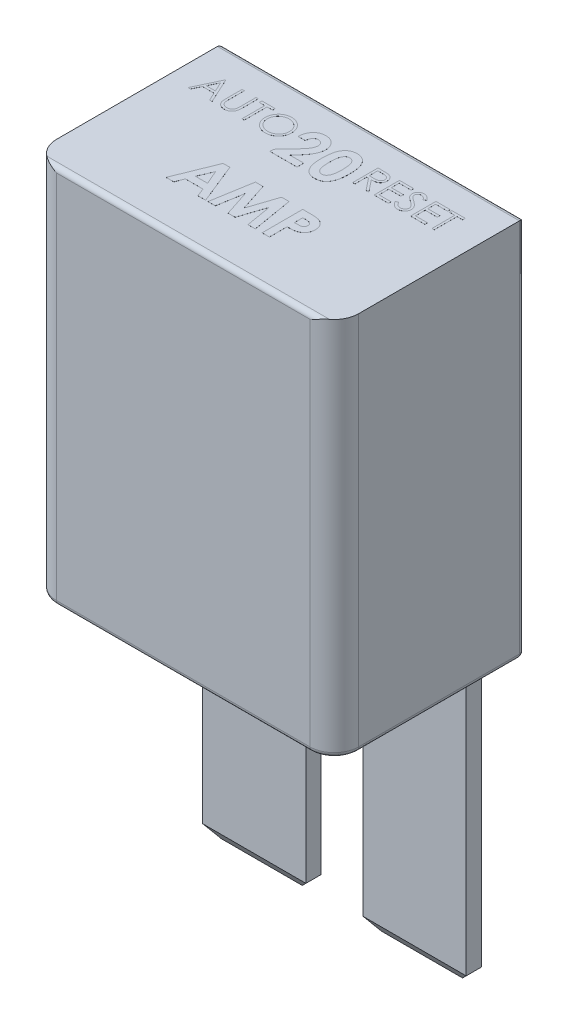
from build123d import *

# Parameters (mm, degrees)
SKETCH1_W                  = 15.748
SKETCH1_H                  = 9.906
EXTRUDE1_DEPTH             = 19.812
FILLET1_R                  = 1.27
FILLET2_R                  = 0.254
SKETCH2_W                  = 5.3848
SKETCH2_H                  = 0.7874
EXTRUDE2_DEPTH             = 14.478
CHAMFER1_SIZE              = 0.5842
CHAMFER2_SIZE              = 0.5842
CHAMFER2_SIZE_2            = 0.394047876
CHAMFER1_OF_MIRROR1_SIZE   = 0.5842
CHAMFER2_OF_MIRROR1_SIZE   = 0.394047876
CHAMFER2_OF_MIRROR1_SIZE_2 = 0.5842
EXTRUDE3_DEPTH             = 0.00254


with BuildPart() as part:
    # Sketch1 → Extrude1 (new body)
    with BuildSketch(Plane(origin=(0, 0, 0), x_dir=(1, 0, 0), z_dir=(0, 1, 0))):
        Rectangle(SKETCH1_W, SKETCH1_H)
    extrude(amount=EXTRUDE1_DEPTH)

    # Fillet1
    fillet1_edges = [part.edges().sort_by_distance(p)[0] for p in [
        (7.874, 9.906, 4.953),
        (-7.874, 9.906, 4.953),
    ]]
    fillet(fillet1_edges, radius=FILLET1_R)

    # Fillet2
    # the kernel refuses this fillet: 0.254 mm, written as the material it takes off along each edge
    with BuildSketch(Plane(origin=(7.62, 0.254, -4.699), x_dir=(1, 0, 0), z_dir=(0, -1, 0))) as fillet2_piece_1_section:
        Polygon((0, 0), (FILLET2_R * 1.02, 0), (FILLET2_R * 1.02, -FILLET2_R * 1.02), (0, -FILLET2_R * 1.02), align=None)
    fillet2_piece_1 = extrude(amount=FILLET2_R * 1.02, mode=Mode.PRIVATE)
    fillet2_piece_1 = fillet2_piece_1 - Plane(origin=(7.62, 0.254, -4.699), x_dir=(-0.7071067811865475, 0, 0.7071067811865475), z_dir=(0, -1, 0)) * Sphere(FILLET2_R, mode=Mode.PRIVATE)
    add(fillet2_piece_1, mode=Mode.SUBTRACT)
    with BuildSketch(Plane(origin=(-7.62, 0.254, -4.699), x_dir=(-1, 0, 0), z_dir=(0, -1, 0))) as fillet2_piece_2_section:
        Polygon((0, 0), (FILLET2_R * 1.02, 0), (FILLET2_R * 1.02, FILLET2_R * 1.02), (0, FILLET2_R * 1.02), align=None)
    fillet2_piece_2 = extrude(amount=FILLET2_R * 1.02, mode=Mode.PRIVATE)
    fillet2_piece_2 = fillet2_piece_2 - Plane(origin=(-7.62, 0.254, -4.699), x_dir=(0.7071067811865475, 0, 0.7071067811865475), z_dir=(0, -1, 0)) * Sphere(FILLET2_R, mode=Mode.PRIVATE)
    add(fillet2_piece_2, mode=Mode.SUBTRACT)
    with BuildSketch(Plane(origin=(7.874, 0, 3.683), x_dir=(-1, 0, 0), z_dir=(0, 0, -1)), Plane(origin=(-7.874, 0, -4.699), x_dir=(1, 0, 0), z_dir=(0, 0, 1))) as fillet2_piece_3:
        with BuildLine():
            CenterArc((FILLET2_R, FILLET2_R), FILLET2_R, 180, 90)
            Line((0, FILLET2_R), (-FILLET2_R * 0.02, FILLET2_R))
            Line((-FILLET2_R * 0.02, FILLET2_R), (-FILLET2_R * 0.02, -FILLET2_R * 0.02))
            Line((-FILLET2_R * 0.02, -FILLET2_R * 0.02), (FILLET2_R, -FILLET2_R * 0.02))
            Line((FILLET2_R, -FILLET2_R * 0.02), (FILLET2_R, 0))
        make_face()
    extrude(amount=8.382, mode=Mode.SUBTRACT)
    with BuildSketch(Plane(origin=(-6.604, 0, 4.953), x_dir=(0, 1, 0), z_dir=(1, 0, 0))) as fillet2_piece_4:
        with BuildLine():
            CenterArc((FILLET2_R, -FILLET2_R), FILLET2_R, 90, 90)
            Line((0, -FILLET2_R), (-FILLET2_R * 0.02, -FILLET2_R))
            Line((-FILLET2_R * 0.02, -FILLET2_R), (-FILLET2_R * 0.02, FILLET2_R * 0.02))
            Line((-FILLET2_R * 0.02, FILLET2_R * 0.02), (FILLET2_R, FILLET2_R * 0.02))
            Line((FILLET2_R, FILLET2_R * 0.02), (FILLET2_R, 0))
        make_face()
    extrude(amount=13.208, mode=Mode.SUBTRACT)
    with BuildSketch(Plane(origin=(-6.604, 0, 3.683), x_dir=(0, 0, 1), z_dir=(1, 0, 0))) as fillet2_piece_5:
        with BuildLine():
            CenterArc((1.27 - FILLET2_R, -FILLET2_R), FILLET2_R, 0, 90)
            Line((1.27, -FILLET2_R), (1.27 + FILLET2_R * 0.02, -FILLET2_R))
            Line((1.27 + FILLET2_R * 0.02, -FILLET2_R), (1.27 + FILLET2_R * 0.02, FILLET2_R * 0.02))
            Line((1.27 + FILLET2_R * 0.02, FILLET2_R * 0.02), (1.27 - FILLET2_R, FILLET2_R * 0.02))
            Line((1.27 - FILLET2_R, FILLET2_R * 0.02), (1.27 - FILLET2_R, 0))
        make_face()
    revolve(axis=Axis((-6.604, 0, 3.683), (0, -1, 0)), revolution_arc=90, mode=Mode.SUBTRACT)
    with BuildSketch(Plane(origin=(6.604, 0, 3.683), x_dir=(0, 0, 1), z_dir=(-1, 0, 0))) as fillet2_piece_6:
        with BuildLine():
            CenterArc((1.27 - FILLET2_R, FILLET2_R), FILLET2_R, 270, 90)
            Line((1.27, FILLET2_R), (1.27 + FILLET2_R * 0.02, FILLET2_R))
            Line((1.27 + FILLET2_R * 0.02, FILLET2_R), (1.27 + FILLET2_R * 0.02, -FILLET2_R * 0.02))
            Line((1.27 + FILLET2_R * 0.02, -FILLET2_R * 0.02), (1.27 - FILLET2_R, -FILLET2_R * 0.02))
            Line((1.27 - FILLET2_R, -FILLET2_R * 0.02), (1.27 - FILLET2_R, 0))
        make_face()
    revolve(axis=Axis((6.604, 0, 3.683), (0, 1, 0)), revolution_arc=90, mode=Mode.SUBTRACT)
    with BuildSketch(Plane(origin=(-8.128, 19.812, 4.953), x_dir=(0, -1, 0), z_dir=(1, 0, 0))) as fillet2_piece_7:
        with BuildLine():
            CenterArc((FILLET2_R, FILLET2_R), FILLET2_R, 180, 90)
            Line((0, FILLET2_R), (-FILLET2_R * 0.02, FILLET2_R))
            Line((-FILLET2_R * 0.02, FILLET2_R), (-FILLET2_R * 0.02, -FILLET2_R * 0.02))
            Line((-FILLET2_R * 0.02, -FILLET2_R * 0.02), (FILLET2_R, -FILLET2_R * 0.02))
            Line((FILLET2_R, -FILLET2_R * 0.02), (FILLET2_R, 0))
        make_face()
    extrude(amount=16.256, mode=Mode.SUBTRACT)
    with BuildSketch(Plane(origin=(7.62, 0, -4.953), x_dir=(0, 0, 1), z_dir=(-1, 0, 0))) as fillet2_piece_8:
        with BuildLine():
            CenterArc((FILLET2_R, FILLET2_R), FILLET2_R, 180, 90)
            Line((0, FILLET2_R), (-FILLET2_R * 0.02, FILLET2_R))
            Line((-FILLET2_R * 0.02, FILLET2_R), (-FILLET2_R * 0.02, -FILLET2_R * 0.02))
            Line((-FILLET2_R * 0.02, -FILLET2_R * 0.02), (FILLET2_R, -FILLET2_R * 0.02))
            Line((FILLET2_R, -FILLET2_R * 0.02), (FILLET2_R, 0))
        make_face()
    extrude(amount=15.24, mode=Mode.SUBTRACT)
    with BuildSketch(Plane(origin=(9.398, 19.812, -4.953), x_dir=(0, 0, 1), z_dir=(-1, 0, 0))) as fillet2_piece_9:
        with BuildLine():
            CenterArc((FILLET2_R, -FILLET2_R), FILLET2_R, 90, 90)
            Line((0, -FILLET2_R), (-FILLET2_R * 0.02, -FILLET2_R))
            Line((-FILLET2_R * 0.02, -FILLET2_R), (-FILLET2_R * 0.02, FILLET2_R * 0.02))
            Line((-FILLET2_R * 0.02, FILLET2_R * 0.02), (FILLET2_R, FILLET2_R * 0.02))
            Line((FILLET2_R, FILLET2_R * 0.02), (FILLET2_R, 0))
        make_face()
    extrude(amount=18.796, mode=Mode.SUBTRACT)
    with BuildSketch(Plane(origin=(-7.874, 0.254, -4.953), x_dir=(0, 0, 1), z_dir=(0, 1, 0))) as fillet2_piece_10:
        with BuildLine():
            CenterArc((FILLET2_R, FILLET2_R), FILLET2_R, 180, 90)
            Line((0, FILLET2_R), (-FILLET2_R * 0.02, FILLET2_R))
            Line((-FILLET2_R * 0.02, FILLET2_R), (-FILLET2_R * 0.02, -FILLET2_R * 0.02))
            Line((-FILLET2_R * 0.02, -FILLET2_R * 0.02), (FILLET2_R, -FILLET2_R * 0.02))
            Line((FILLET2_R, -FILLET2_R * 0.02), (FILLET2_R, 0))
        make_face()
    extrude(amount=21.082, mode=Mode.SUBTRACT)
    with BuildSketch(Plane(origin=(7.874, 0.254, -4.953), x_dir=(0, 0, 1), z_dir=(0, 1, 0))) as fillet2_piece_11:
        with BuildLine():
            CenterArc((FILLET2_R, -FILLET2_R), FILLET2_R, 90, 90)
            Line((0, -FILLET2_R), (-FILLET2_R * 0.02, -FILLET2_R))
            Line((-FILLET2_R * 0.02, -FILLET2_R), (-FILLET2_R * 0.02, FILLET2_R * 0.02))
            Line((-FILLET2_R * 0.02, FILLET2_R * 0.02), (FILLET2_R, FILLET2_R * 0.02))
            Line((FILLET2_R, FILLET2_R * 0.02), (FILLET2_R, 0))
        make_face()
    extrude(amount=21.082, mode=Mode.SUBTRACT)

    # Sketch2 → Extrude2 (add)
    with BuildSketch(Plane.XZ):
        with Locations((-4.1783, -3.31978)):
            Rectangle(SKETCH2_W, SKETCH2_H)
    extrude2 = extrude(amount=EXTRUDE2_DEPTH)

    # Chamfer1
    chamfer1_edges = [part.edges().sort_by_distance(p)[0] for p in [
        (-1.4859, -14.478, -3.31978),
        (-6.8707, -14.478, -3.31978),
    ]]
    chamfer(chamfer1_edges, length=CHAMFER1_SIZE)

    # Chamfer2
    # the kernel refuses this chamfer: 0.5842, 0.394047876 mm, written as the material it takes off along each edge
    with BuildSketch(Plane(origin=(-7.795785962, -14.478, -3.71348), x_dir=(0, 0.9997657259302418, -0.021644705014774092), z_dir=(1, 0, 0)), Plane(origin=(-0.560814038, -14.478, -2.92608), x_dir=(0, 0.9997657259302418, 0.021644705014774092), z_dir=(-1, 0, 0))) as chamfer2_piece_1:
        Polygon((CHAMFER2_SIZE * 0.99976572593, CHAMFER2_SIZE * 0.0216447050148), (-CHAMFER2_SIZE_2 * 0.0216447049895, CHAMFER2_SIZE_2 * 0.999765724761), (0, 0), align=None)
    extrude(amount=7.234971923, mode=Mode.SUBTRACT)

    # Mirror1: Extrude2 across plane
    add(extrude2.mirror(Plane(origin=(0, 0, 0), x_dir=(0, 0, 1), z_dir=(1, 0, 0))))

    # Chamfer1 of Mirror1
    chamfer1_of_mirror1_edges = [part.edges().sort_by_distance(p)[0] for p in [
        (1.4859, -14.478, -3.31978),
        (6.8707, -14.478, -3.31978),
    ]]
    chamfer(chamfer1_of_mirror1_edges, length=CHAMFER1_OF_MIRROR1_SIZE)

    # Chamfer2 of Mirror1
    # the kernel refuses this chamfer: 0.5842, 0.394047876 mm, written as the material it takes off along each edge
    with BuildSketch(Plane(origin=(7.795785962, -14.478, -3.71348), x_dir=(0, -0.04753214298802765, 0.9988697089125117), z_dir=(-1, 0, 0))) as chamfer2_of_mirror1_piece_1:
        Polygon((CHAMFER2_OF_MIRROR1_SIZE * 0.998869707745, CHAMFER2_OF_MIRROR1_SIZE * 0.0475321429325), (-CHAMFER2_OF_MIRROR1_SIZE_2 * 0.047532142988, CHAMFER2_OF_MIRROR1_SIZE_2 * 0.998869708913), (0, 0), align=None)
    extrude(amount=7.234971923, mode=Mode.SUBTRACT)
    with BuildSketch(Plane(origin=(0.560814038, -14.478, -2.92608), x_dir=(0, 0.9997657259302418, 0.021644705014774092), z_dir=(1, 0, 0))) as chamfer2_of_mirror1_piece_2:
        Polygon((CHAMFER2_OF_MIRROR1_SIZE_2 * 0.99976572593, -CHAMFER2_OF_MIRROR1_SIZE_2 * 0.0216447050148), (-CHAMFER2_OF_MIRROR1_SIZE * 0.0216447049895, -CHAMFER2_OF_MIRROR1_SIZE * 0.999765724761), (0, 0), align=None)
    extrude(amount=7.234971923, mode=Mode.SUBTRACT)

    # Sketch3 → Extrude3 (add)
    # profile 1 of 14: a face of its own
    with BuildSketch(Plane(origin=(0, 19.812, 0), x_dir=(1, 0, 0), z_dir=(0, 1, 0))):
        Polygon((-6.136355455, 3.397993818), (-5.525778532, 2.075077152), (-5.654837109, 2.075077152), (-5.850412529, 2.499088904), (-6.450124151, 2.499088904), (-6.651264726, 2.075077152), (-6.780853318, 2.075077152), (-6.153315925, 3.397993818), align=None)
        Polygon((-6.146160726, 3.140141672), (-6.385727366, 2.634772665), (-5.912954263, 2.634772665), align=None, mode=Mode.SUBTRACT)
    # profile 2 of 14: a face of its own
    with BuildSketch(Plane(origin=(0, 19.812, 0), x_dir=(1, 0, 0), z_dir=(0, 1, 0))):
        with BuildLine():
            Line((-5.28833195, 3.397993818), (-5.16960866, 3.397993818))
            Line((-5.16960866, 3.397993818), (-5.16960866, 2.605356849))
            add(Edge.make_bspline(
                [(-5.16960866, 2.605356849), (-5.169626328, 2.594138238), (-5.169659856, 2.572848989), (-5.1694359, 2.54254728), (-5.168808698, 2.515607988), (-5.168413275, 2.49192727), (-5.167533598, 2.471613791), (-5.166816182, 2.454557498), (-5.165893709, 2.440839154), (-5.164785061, 2.432833268), (-5.164308513, 2.429391972)],
                knots=[0, 0, 0, 0, 1.528628734, 2.90083645, 4.128790002, 5.200304208, 6.127813768, 6.898992206, 7.526736466, 8, 8, 8, 8], degree=3))
            add(Edge.make_bspline(
                [(-5.164308513, 2.429391972), (-5.162351557, 2.416976678), (-5.158547912, 2.392845646), (-5.148854192, 2.35848448), (-5.135316029, 2.32751634), (-5.119273569, 2.298974869), (-5.098132374, 2.273654486), (-5.072806633, 2.250328951), (-5.042123369, 2.229928894), (-5.00800701, 2.211275462), (-4.971235506, 2.196283005), (-4.933660414, 2.184946228), (-4.89584655, 2.178037239), (-4.870531154, 2.177237237), (-4.857960022, 2.176839972)],
                knots=[0, 0, 0, 0, 1.035780045, 2.013197591, 2.933192213, 3.817615948, 4.702609284, 5.640816605, 6.646850145, 7.73207398, 8.84249596, 9.914020372, 10.964143139, 12, 12, 12, 12], degree=3))
            add(Edge.make_bspline(
                [(-4.857960022, 2.176839972), (-4.847167388, 2.177245862), (-4.825644455, 2.178055297), (-4.793665239, 2.183067803), (-4.76251996, 2.192101647), (-4.732054822, 2.203758342), (-4.703498349, 2.219159961), (-4.676834607, 2.236951618), (-4.653035739, 2.257820014), (-4.631317984, 2.28091449), (-4.612405969, 2.306972093), (-4.596012711, 2.335425436), (-4.582584755, 2.366702719), (-4.57595372, 2.388683706), (-4.572547111, 2.399976157)],
                knots=[0, 0, 0, 0, 0.994687771, 1.983630487, 2.973142513, 3.978332533, 4.983357753, 5.956394766, 6.925816176, 7.893390482, 8.871859704, 9.88551698, 10.913711441, 12, 12, 12, 12], degree=3))
            add(Edge.make_bspline(
                [(-4.572547111, 2.399976157), (-4.571413135, 2.404643624), (-4.56888618, 2.415044622), (-4.566524946, 2.432628562), (-4.564065634, 2.453375434), (-4.562359234, 2.477434304), (-4.560695678, 2.504724553), (-4.559700439, 2.535388346), (-4.559240429, 2.569314341), (-4.559103345, 2.592989696), (-4.559031737, 2.605356849)],
                knots=[0, 0, 0, 0, 0.558680831, 1.244966039, 2.062412453, 2.990489873, 4.051219941, 5.244515665, 6.560634259, 8, 8, 8, 8], degree=3))
            Line((-4.559031737, 2.605356849), (-4.559031737, 3.397993818))
            Line((-4.559031737, 3.397993818), (-4.440308446, 3.397993818))
            Line((-4.440308446, 3.397993818), (-4.440308446, 2.598996673))
            add(Edge.make_bspline(
                [(-4.440308446, 2.598996673), (-4.440404498, 2.584596393), (-4.440591948, 2.556493371), (-4.442217463, 2.515312351), (-4.444809246, 2.476247385), (-4.448471113, 2.439293221), (-4.453323194, 2.404582095), (-4.458718888, 2.371809757), (-4.465590318, 2.341211454), (-4.473616038, 2.312548605), (-4.482790862, 2.2852642), (-4.494674867, 2.259369575), (-4.508064485, 2.234077525), (-4.523945023, 2.209770591), (-4.541789802, 2.18634115), (-4.561993264, 2.163931291), (-4.583887218, 2.142182901), (-4.607835623, 2.121653855), (-4.633443708, 2.102827362), (-4.660635299, 2.086272847), (-4.689201519, 2.072278801), (-4.719068111, 2.060759627), (-4.750247822, 2.052098454), (-4.782741437, 2.045644452), (-4.816622918, 2.041977214), (-4.839666106, 2.041432199), (-4.851334838, 2.041156212)],
                knots=[0, 0, 0, 0, 1.316592851, 2.569410997, 3.76748051, 4.895814652, 5.963796859, 6.97159953, 7.931736103, 8.829262218, 9.692595152, 10.560224239, 11.431080259, 12.30701507, 13.211635791, 14.121146779, 15.063487852, 16.031507147, 17.00238618, 17.966455255, 18.938106653, 19.907068911, 20.888905087, 21.893141452, 22.933117798, 24, 24, 24, 24], degree=3))
            add(Edge.make_bspline(
                [(-4.851334838, 2.041156212), (-4.864060957, 2.041452834), (-4.889029558, 2.042034807), (-4.92582103, 2.045369596), (-4.961091574, 2.051650953), (-4.995213706, 2.059648908), (-5.02772287, 2.070679666), (-5.059054618, 2.083567946), (-5.088672334, 2.099396553), (-5.117056505, 2.117007746), (-5.1434486, 2.136823011), (-5.167675892, 2.158420636), (-5.189778379, 2.181454648), (-5.209383511, 2.206174429), (-5.226816108, 2.232387723), (-5.241833182, 2.260168686), (-5.254727177, 2.289506561), (-5.26138204, 2.309899586), (-5.264746297, 2.320208946)],
                knots=[0, 0, 0, 0, 1.13879206, 2.234305948, 3.301075583, 4.341971843, 5.366689343, 6.369221514, 7.369726634, 8.367512178, 9.355451585, 10.318319045, 11.268648973, 12.207971039, 13.137398894, 14.081662264, 15.030215811, 16, 16, 16, 16], degree=3))
            add(Edge.make_bspline(
                [(-5.264746297, 2.320208946), (-5.266703139, 2.327251615), (-5.270947574, 2.342527322), (-5.27549285, 2.367808823), (-5.279313843, 2.396918628), (-5.282906717, 2.429858731), (-5.28502677, 2.466654662), (-5.286885445, 2.507290473), (-5.288345044, 2.551815298), (-5.288336437, 2.582829951), (-5.28833195, 2.598996673)],
                knots=[0, 0, 0, 0, 0.625038921, 1.35572334, 2.194682327, 3.136881307, 4.189498639, 5.346923369, 6.617055217, 8, 8, 8, 8], degree=3))
            Line((-5.28833195, 2.598996673), (-5.28833195, 3.397993818))
        make_face()
    # profile 3 of 14: a face of its own
    with BuildSketch(Plane(origin=(0, 19.812, 0), x_dir=(1, 0, 0), z_dir=(0, 1, 0))):
        Polygon((-4.253743275, 3.262310058), (-4.253743275, 3.397993818), (-3.558364002, 3.397993818), (-3.558364002, 3.262310058), (-3.846691993, 3.262310058), (-3.846691993, 2.075077152), (-3.965415284, 2.075077152), (-3.965415284, 3.262310058), align=None)
    # profile 4 of 14: a face of its own
    with BuildSketch(Plane(origin=(0, 19.812, 0), x_dir=(1, 0, 0), z_dir=(0, 1, 0))):
        with BuildLine():
            add(Edge.make_bspline(
                [(-2.735781202, 3.431914759), (-2.711285281, 3.431294318), (-2.663173272, 3.430075723), (-2.592463414, 3.420747609), (-2.524958721, 3.404609768), (-2.460109293, 3.383116915), (-2.398690817, 3.354445763), (-2.340240998, 3.31979096), (-2.284898905, 3.278789442), (-2.233410466, 3.231758156), (-2.186293107, 3.180586434), (-2.144781537, 3.125977224), (-2.109991742, 3.068260713), (-2.081422114, 3.007610339), (-2.059008651, 2.944163268), (-2.043542227, 2.877581249), (-2.033662628, 2.808295685), (-2.032507617, 2.761038507), (-2.031921694, 2.7370655)],
                knots=[0, 0, 0, 0, 1.065120563, 2.091984664, 3.0946048, 4.079830382, 5.057816894, 6.036188127, 7.030412546, 8.04752943, 9.064399622, 10.05169764, 11.02544977, 11.989514704, 12.962713494, 13.945757189, 14.957906945, 16, 16, 16, 16], degree=3))
            add(Edge.make_bspline(
                [(-2.031921694, 2.7370655), (-2.032507532, 2.713269084), (-2.033662285, 2.666363592), (-2.04355346, 2.597517707), (-2.059065981, 2.531337592), (-2.081213974, 2.467933729), (-2.109647414, 2.407239234), (-2.144668863, 2.349413808), (-2.185921642, 2.294438494), (-2.232868874, 2.242915552), (-2.284047244, 2.195669484), (-2.338940827, 2.154500743), (-2.396315088, 2.119075255), (-2.456908341, 2.090808807), (-2.519916986, 2.068216444), (-2.585904947, 2.05281292), (-2.65456302, 2.042877044), (-2.70138331, 2.041736117), (-2.725180909, 2.041156212)],
                knots=[0, 0, 0, 0, 1.043624062, 2.057103931, 3.04512605, 4.022047818, 4.998200453, 5.980619268, 6.982898556, 8.009068085, 9.034988726, 10.034168286, 11.015286542, 11.987931943, 12.962482838, 13.94673481, 14.956375938, 16, 16, 16, 16], degree=3))
            add(Edge.make_bspline(
                [(-2.725180909, 2.041156212), (-2.749153791, 2.041741843), (-2.796410724, 2.042896278), (-2.865783353, 2.052792226), (-2.932412143, 2.068267064), (-2.996106556, 2.090382238), (-3.05690211, 2.11896375), (-3.114917706, 2.15381481), (-3.169920479, 2.195168105), (-3.221454413, 2.242100114), (-3.26860664, 2.293191742), (-3.309715095, 2.347935642), (-3.344573992, 2.405257794), (-3.373059537, 2.465317275), (-3.395611282, 2.527823742), (-3.410996734, 2.593194149), (-3.420951097, 2.661055808), (-3.422098197, 2.707260713), (-3.422680241, 2.730705323)],
                knots=[0, 0, 0, 0, 1.053102029, 2.075944431, 3.073151272, 4.055350789, 5.033113405, 6.020478099, 7.024410459, 8.052272461, 9.079885166, 10.07527673, 11.055994387, 12.023226415, 12.992069828, 13.970394897, 14.97016774, 16, 16, 16, 16], degree=3))
            add(Edge.make_bspline(
                [(-3.422680241, 2.730705323), (-3.422478161, 2.746441481), (-3.422076552, 2.777715278), (-3.417241597, 2.824155927), (-3.410225715, 2.869849718), (-3.400170826, 2.914666713), (-3.387020404, 2.958497204), (-3.371503715, 3.001643474), (-3.352552047, 3.043668275), (-3.331128112, 3.084770688), (-3.307216655, 3.124309986), (-3.280805285, 3.161684114), (-3.252821679, 3.197206693), (-3.222143848, 3.229957197), (-3.189782871, 3.260888371), (-3.155213781, 3.289524874), (-3.118647516, 3.31612493), (-3.079926736, 3.340096309), (-3.040005543, 3.361776696), (-2.998852713, 3.380381384), (-2.957027164, 3.396349389), (-2.914332996, 3.409291606), (-2.870883585, 3.419509072), (-2.826584101, 3.426466613), (-2.781469836, 3.4313139), (-2.751076272, 3.431713611), (-2.735781202, 3.431914759)],
                knots=[0, 0, 0, 0, 1.037015668, 2.060948919, 3.074880161, 4.083647147, 5.086022904, 6.090072063, 7.104153813, 8.122640571, 9.144368836, 10.147691507, 11.138137339, 12.123020368, 13.103399296, 14.087645067, 15.080126199, 16.082011238, 17.087798457, 18.072939717, 19.057185487, 20.037253025, 21.01195951, 21.997135196, 22.992090687, 24, 24, 24, 24], degree=3))
        make_face()
        with BuildLine():
            add(Edge.make_bspline(
                [(-2.729951041, 3.296230998), (-2.742505382, 3.296077959), (-2.767494042, 3.295773344), (-2.804643257, 3.291760857), (-2.841303899, 3.286042119), (-2.877483539, 3.277884818), (-2.913030797, 3.266770786), (-2.948277017, 3.253979728), (-2.98290079, 3.238399138), (-3.016787814, 3.220795764), (-3.049639643, 3.201311499), (-3.080638491, 3.179777528), (-3.109864609, 3.156698848), (-3.137246439, 3.1320216), (-3.162703579, 3.105620114), (-3.186737082, 3.077894639), (-3.20838362, 3.048052704), (-3.228221919, 3.016903533), (-3.245974644, 2.984487697), (-3.261760954, 2.951146469), (-3.274674136, 2.916607879), (-3.28520545, 2.881246635), (-3.293936629, 2.845118741), (-3.299467904, 2.807950132), (-3.30352448, 2.769927575), (-3.303811684, 2.744232052), (-3.30395695, 2.731235338)],
                knots=[0, 0, 0, 0, 1.008559885, 2.007477868, 2.99961109, 3.989939068, 4.984837346, 5.991145699, 7.001802488, 8.033829008, 9.059044045, 10.069351652, 11.065060232, 12.050310815, 13.029377138, 14.011219647, 14.996725999, 15.989392538, 16.977580475, 17.965360261, 18.951710183, 19.937753436, 20.929683414, 21.935841486, 22.955955122, 24, 24, 24, 24], degree=3))
            add(Edge.make_bspline(
                [(-3.30395695, 2.731235338), (-3.303475083, 2.712124023), (-3.3025271, 2.674526152), (-3.294227662, 2.619429265), (-3.281443761, 2.566479228), (-3.262598863, 2.515965768), (-3.239031815, 2.467454685), (-3.209917485, 2.421376324), (-3.175423723, 2.377718232), (-3.136241379, 2.336785198), (-3.093408094, 2.299423838), (-3.047925187, 2.266629335), (-3.000279924, 2.238882009), (-2.950348059, 2.216277115), (-2.898396162, 2.198364923), (-2.844089469, 2.186088773), (-2.787789741, 2.17800936), (-2.749413571, 2.177233467), (-2.729951041, 2.176839972)],
                knots=[0, 0, 0, 0, 1.032063989, 2.030389145, 3.003944642, 3.970395727, 4.937377036, 5.913328081, 6.909231446, 7.93887556, 8.970685674, 9.976071282, 10.964166581, 11.944589148, 12.933237628, 13.927779006, 14.949070134, 16, 16, 16, 16], degree=3))
            add(Edge.make_bspline(
                [(-2.729951041, 2.176839972), (-2.716869473, 2.177019702), (-2.690924796, 2.177376159), (-2.652335119, 2.180966432), (-2.614440658, 2.186723716), (-2.577294564, 2.195012982), (-2.540938996, 2.205387373), (-2.50522221, 2.217712317), (-2.470524642, 2.233088844), (-2.436408572, 2.250078099), (-2.40375285, 2.269445659), (-2.372579063, 2.290248769), (-2.343672963, 2.313293456), (-2.316311618, 2.337604058), (-2.290749961, 2.36367075), (-2.267160851, 2.391459644), (-2.245623718, 2.421146142), (-2.225792953, 2.452248066), (-2.208102434, 2.484752602), (-2.192688905, 2.518214713), (-2.179612397, 2.552552001), (-2.169056087, 2.587813994), (-2.160783904, 2.623933719), (-2.155084053, 2.660959541), (-2.151096995, 2.698817387), (-2.150796474, 2.724422952), (-2.150644985, 2.737330507)],
                knots=[0, 0, 0, 0, 1.047197238, 2.076906641, 3.100256066, 4.114471768, 5.12198147, 6.126382909, 7.136867548, 8.15857795, 9.17633901, 10.174870724, 11.156907918, 12.133735059, 13.104061851, 14.077631395, 15.04955518, 16.038496417, 17.029181396, 18.010275684, 18.986308667, 19.968651475, 20.955262928, 21.950658345, 22.966943676, 24, 24, 24, 24], degree=3))
            add(Edge.make_bspline(
                [(-2.150644985, 2.737330507), (-2.150796596, 2.75014976), (-2.151097344, 2.77557911), (-2.155082149, 2.813172931), (-2.160789926, 2.84993233), (-2.169015711, 2.885712993), (-2.179618001, 2.920524043), (-2.192691189, 2.954332784), (-2.208107061, 2.987265167), (-2.225799455, 3.019239797), (-2.245686984, 3.049921916), (-2.267418439, 3.07925378), (-2.291369032, 3.106684548), (-2.316854464, 3.132891412), (-2.344511316, 3.157315435), (-2.374214308, 3.179964721), (-2.405602841, 3.20138587), (-2.438837243, 3.220710115), (-2.473136297, 3.238555971), (-2.508331156, 3.253845487), (-2.544023107, 3.26683733), (-2.580121388, 3.277918444), (-2.616929835, 3.28601017), (-2.654199735, 3.29176601), (-2.691879523, 3.295771948), (-2.717220264, 3.296077496), (-2.729951041, 3.296230998)],
                knots=[0, 0, 0, 0, 1.02996197, 2.043119294, 3.035359645, 4.018872909, 4.991431989, 5.957985074, 6.929999688, 7.912076566, 8.892894881, 9.867085534, 10.843653904, 11.817741046, 12.803660682, 13.806313499, 14.818574707, 15.856120519, 16.894564902, 17.924820532, 18.937903209, 19.946497019, 20.957711757, 21.963978472, 22.977135795, 24, 24, 24, 24], degree=3))
        make_face(mode=Mode.SUBTRACT)
    # profile 5 of 14: a face of its own
    with BuildSketch(Plane(origin=(0, 19.812, 0), x_dir=(1, 0, 0), z_dir=(0, 1, 0))):
        with BuildLine():
            Line((1.801144545, 3.397993818), (2.065886883, 3.397993818))
            add(Edge.make_bspline(
                [(2.065886883, 3.397993818), (2.083553917, 3.397935011), (2.117476579, 3.397822093), (2.166074213, 3.397192474), (2.210232075, 3.395387882), (2.249927073, 3.393834935), (2.285158482, 3.391003159), (2.316034333, 3.388296605), (2.342412421, 3.384753585), (2.358380347, 3.381463142), (2.36561019, 3.379973319)],
                knots=[0, 0, 0, 0, 1.410062039, 2.707475311, 3.878576406, 4.937260626, 5.877586885, 6.699081471, 7.410979367, 8, 8, 8, 8], degree=3))
            add(Edge.make_bspline(
                [(2.36561019, 3.379973319), (2.375288885, 3.377581952), (2.3944398, 3.372850233), (2.422013188, 3.362849134), (2.448287948, 3.351275645), (2.473154935, 3.337682215), (2.496489594, 3.321967938), (2.518532527, 3.304404094), (2.539383759, 3.285086787), (2.55820003, 3.263528975), (2.575941874, 3.240912199), (2.590905432, 3.21645572), (2.603804429, 3.190881273), (2.614074237, 3.163928767), (2.62234359, 3.135859586), (2.628174341, 3.106419475), (2.63167107, 3.075742559), (2.632027069, 3.054818587), (2.63220758, 3.044209013)],
                knots=[0, 0, 0, 0, 1.027469482, 2.033020251, 3.019912614, 3.986113645, 4.951240523, 5.91722682, 6.890402269, 7.87763091, 8.8651537, 9.85103654, 10.82876324, 11.815024772, 12.821070561, 13.842952187, 14.906261191, 16, 16, 16, 16], degree=3))
            add(Edge.make_bspline(
                [(2.63220758, 3.044209013), (2.631652333, 3.026582054), (2.630568904, 2.992187291), (2.620467451, 2.942271422), (2.603920969, 2.895708794), (2.581120202, 2.852558035), (2.552084269, 2.813660261), (2.517187696, 2.779494821), (2.476411016, 2.750904735), (2.438451126, 2.731078824), (2.40491927, 2.718381504), (2.377314417, 2.709447523), (2.347202196, 2.702544935), (2.31487112, 2.696361195), (2.280186643, 2.691692549), (2.243231896, 2.688273151), (2.203980524, 2.686136056), (2.177016054, 2.685817798), (2.163144579, 2.685654075)],
                knots=[0, 0, 0, 0, 1.260483769, 2.459530307, 3.627416485, 4.787058657, 5.939039949, 7.08810263, 8.267026773, 9.491475466, 10.141966685, 10.831826277, 11.566392101, 12.351337768, 13.187381173, 14.07005841, 15.007169909, 16, 16, 16, 16], degree=3))
            Line((2.163144579, 2.685654075), (2.64916805, 2.075077152))
            Line((2.64916805, 2.075077152), (2.50235398, 2.075077152))
            Line((2.50235398, 2.075077152), (2.01633051, 2.685654075))
            Line((2.01633051, 2.685654075), (1.919867836, 2.685654075))
            Line((1.919867836, 2.685654075), (1.919867836, 2.075077152))
            Line((1.919867836, 2.075077152), (1.801144545, 2.075077152))
            Line((1.801144545, 2.075077152), (1.801144545, 3.397993818))
        make_face()
        with BuildLine():
            Line((1.919867836, 3.262310058), (1.919867836, 2.821337835))
            Line((1.919867836, 2.821337835), (2.162084549, 2.819482784))
            add(Edge.make_bspline(
                [(2.162084549, 2.819482784), (2.173393612, 2.819477781), (2.195313796, 2.819468083), (2.227026249, 2.820977636), (2.256553791, 2.822694902), (2.28378348, 2.825321589), (2.308727481, 2.828706771), (2.331373324, 2.832941232), (2.351757978, 2.837874601), (2.375532128, 2.845510335), (2.402079864, 2.857607848), (2.430931339, 2.875208497), (2.455500675, 2.89734623), (2.476258319, 2.922660602), (2.492938194, 2.95049335), (2.504697809, 2.980510847), (2.512159982, 3.01195529), (2.513040117, 3.033567254), (2.513484289, 3.04447402)],
                knots=[0, 0, 0, 0, 1.146690395, 2.22261258, 3.21895312, 4.145990853, 4.996080663, 5.770904154, 6.481378293, 7.121626537, 8.300444488, 9.431385265, 10.535395872, 11.636531494, 12.74115979, 13.810798291, 14.895190096, 16, 16, 16, 16], degree=3))
            add(Edge.make_bspline(
                [(2.513484289, 3.04447402), (2.513029916, 3.055112755), (2.512129514, 3.076194845), (2.504778343, 3.107058835), (2.49234694, 3.136188307), (2.475594189, 3.163464764), (2.455183794, 3.188224373), (2.431251168, 3.209408862), (2.404450693, 3.226890059), (2.379401758, 3.238060911), (2.357012636, 3.244909784), (2.337573449, 3.24972942), (2.315608694, 3.253601585), (2.29101172, 3.256704037), (2.263887532, 3.259370638), (2.234098982, 3.261166697), (2.201843711, 3.262230271), (2.17948758, 3.262282843), (2.167914711, 3.262310058)],
                knots=[0, 0, 0, 0, 1.101028733, 2.181837193, 3.264309656, 4.369019818, 5.486613113, 6.575447106, 7.666700264, 8.788928104, 9.402425223, 10.0903467, 10.862060571, 11.710948788, 12.657782767, 13.684531032, 14.801375019, 16, 16, 16, 16], degree=3))
            Line((2.167914711, 3.262310058), (1.919867836, 3.262310058))
        make_face(mode=Mode.SUBTRACT)
    # profile 6 of 14: a face of its own
    with BuildSketch(Plane(origin=(0, 19.812, 0), x_dir=(1, 0, 0), z_dir=(0, 1, 0))):
        Polygon((2.920535571, 3.397993818), (3.666796255, 3.397993818), (3.666796255, 3.262310058), (3.039258862, 3.262310058), (3.039258862, 2.855258776), (3.666796255, 2.855258776), (3.666796255, 2.719575015), (3.039258862, 2.719575015), (3.039258862, 2.210760912), (3.666796255, 2.210760912), (3.666796255, 2.075077152), (2.920535571, 2.075077152), align=None)
    # profile 7 of 14: a face of its own
    with BuildSketch(Plane(origin=(0, 19.812, 0), x_dir=(1, 0, 0), z_dir=(0, 1, 0))):
        with BuildLine():
            Line((3.768559075, 2.330279225), (3.880392175, 2.397326083))
            add(Edge.make_bspline(
                [(3.880392175, 2.397326083), (3.890793413, 2.379914843), (3.910721785, 2.346555577), (3.943965305, 2.301478877), (3.978411375, 2.263166396), (4.014315082, 2.231841011), (4.05145727, 2.207178486), (4.09008041, 2.189715142), (4.130054344, 2.178823389), (4.157258735, 2.17750044), (4.170840225, 2.176839972)],
                knots=[0, 0, 0, 0, 1.272034388, 2.437168799, 3.508375237, 4.49857839, 5.41946034, 6.295179144, 7.148887113, 8, 8, 8, 8], degree=3))
            add(Edge.make_bspline(
                [(4.170840225, 2.176839972), (4.182439128, 2.177163018), (4.20543398, 2.177803457), (4.239286375, 2.183957213), (4.272163425, 2.193411202), (4.303387523, 2.206950661), (4.33252783, 2.223331577), (4.358081551, 2.243117186), (4.38017279, 2.265268936), (4.398243497, 2.289982023), (4.412107677, 2.316560231), (4.422763608, 2.343841022), (4.428677073, 2.372252951), (4.42956787, 2.391382501), (4.430017409, 2.401036186)],
                knots=[0, 0, 0, 0, 1.095163259, 2.171163733, 3.241058638, 4.321873601, 5.38011039, 6.391990106, 7.366004449, 8.327778327, 9.272591725, 10.192022065, 11.087607919, 12, 12, 12, 12], degree=3))
            add(Edge.make_bspline(
                [(4.430017409, 2.401036186), (4.429460154, 2.412050734), (4.428327338, 2.434441699), (4.418752641, 2.467476687), (4.403690575, 2.500168819), (4.389795171, 2.520391023), (4.382581094, 2.530889785)],
                knots=[0, 0, 0, 0, 0.938893495, 1.908633276, 2.914225137, 4, 4, 4, 4], degree=3))
            add(Edge.make_bspline(
                [(4.382581094, 2.530889785), (4.376657975, 2.538467007), (4.364223127, 2.554374437), (4.342845734, 2.578052845), (4.317760923, 2.602477068), (4.289827139, 2.628579748), (4.258026835, 2.655146861), (4.223356018, 2.683445288), (4.1849295, 2.71239886), (4.157979988, 2.731816467), (4.144074483, 2.741835632)],
                knots=[0, 0, 0, 0, 0.722233717, 1.516239348, 2.393582979, 3.351407094, 4.387010283, 5.505090956, 6.712668013, 8, 8, 8, 8], degree=3))
            add(Edge.make_bspline(
                [(4.144074483, 2.741835632), (4.13015589, 2.751749414), (4.103544598, 2.770703809), (4.066329598, 2.798834416), (4.033050887, 2.824553379), (4.003856378, 2.848102812), (3.978758912, 2.86948591), (3.957560718, 2.888497333), (3.940801799, 2.905651239), (3.931482576, 2.916779365), (3.927298475, 2.921775619)],
                knots=[0, 0, 0, 0, 1.452282411, 2.77665338, 3.964542531, 5.026858415, 5.96415736, 6.766646006, 7.446254459, 8, 8, 8, 8], degree=3))
            add(Edge.make_bspline(
                [(3.927298475, 2.921775619), (3.921450221, 2.929562321), (3.909948846, 2.944875914), (3.894767052, 2.968811203), (3.881863261, 2.993312853), (3.871747737, 3.018446707), (3.863229583, 3.043859909), (3.857500246, 3.069884041), (3.853912724, 3.096402328), (3.853545336, 3.114247907), (3.853361426, 3.123181202)],
                knots=[0, 0, 0, 0, 1.068054152, 2.10047183, 3.106115577, 4.101338837, 5.06977816, 6.043150881, 7.020423561, 8, 8, 8, 8], degree=3))
            add(Edge.make_bspline(
                [(3.853361426, 3.123181202), (3.853854764, 3.137177575), (3.854830895, 3.164871158), (3.86308609, 3.205326264), (3.876116023, 3.243950297), (3.894370341, 3.280360869), (3.917902138, 3.313609915), (3.945133801, 3.344079894), (3.9775685, 3.369694805), (4.01315595, 3.392075553), (4.052108805, 3.409593209), (4.092926795, 3.422807627), (4.135674795, 3.430295055), (4.164628956, 3.431369553), (4.17932046, 3.431914759)],
                knots=[0, 0, 0, 0, 1.005424448, 1.989358655, 2.955360095, 3.929531133, 4.905563448, 5.876582895, 6.856512386, 7.866279853, 8.892233794, 9.918561126, 10.94386622, 12, 12, 12, 12], degree=3))
            add(Edge.make_bspline(
                [(4.17932046, 3.431914759), (4.194909748, 3.431377068), (4.225911866, 3.430307773), (4.271514397, 3.421010492), (4.315420382, 3.405626607), (4.350739711, 3.388168394), (4.378382154, 3.370731817), (4.399462919, 3.354849324), (4.42082517, 3.336564685), (4.44264122, 3.315829196), (4.46454141, 3.292452596), (4.48685087, 3.266594985), (4.509621769, 3.238414382), (4.524270561, 3.218296788), (4.531780229, 3.207983552)],
                knots=[0, 0, 0, 0, 1.286793592, 2.559021753, 3.825965368, 5.121522368, 5.803751409, 6.523245864, 7.299691795, 8.125521123, 9.008227632, 9.944561021, 10.946284179, 12, 12, 12, 12], degree=3))
            Line((4.531780229, 3.207983552), (4.424452254, 3.126626297))
            add(Edge.make_bspline(
                [(4.424452254, 3.126626297), (4.4179715, 3.134975296), (4.405491083, 3.151053516), (4.38654333, 3.173570055), (4.368684466, 3.194138189), (4.351089524, 3.212003282), (4.334687764, 3.228143671), (4.318768525, 3.241962389), (4.303560898, 3.253594831), (4.284391113, 3.266008915), (4.260307333, 3.278314498), (4.230075083, 3.288727394), (4.198481461, 3.294984813), (4.176963416, 3.29581216), (4.166070093, 3.296230998)],
                knots=[0, 0, 0, 0, 1.181633172, 2.275549214, 3.290209073, 4.226197932, 5.078386478, 5.862611352, 6.581680152, 7.217281963, 8.414376989, 9.595101626, 10.782541182, 12, 12, 12, 12], degree=3))
            add(Edge.make_bspline(
                [(4.166070093, 3.296230998), (4.152403788, 3.295773004), (4.126049607, 3.294889806), (4.088633655, 3.28524386), (4.054958273, 3.270056073), (4.026023226, 3.248770352), (4.001932166, 3.223551406), (3.9845054, 3.194530826), (3.974016499, 3.162485097), (3.972736566, 3.140130959), (3.972084716, 3.128746356)],
                knots=[0, 0, 0, 0, 1.14458467, 2.207223713, 3.21896685, 4.227309161, 5.202851033, 6.127160689, 7.046193047, 8, 8, 8, 8], degree=3))
            add(Edge.make_bspline(
                [(3.972084716, 3.128746356), (3.972233309, 3.121658743), (3.972530737, 3.107471929), (3.976678949, 3.086512612), (3.98200816, 3.065606242), (3.990453143, 3.044846814), (4.002111933, 3.023871267), (4.017421925, 3.002318408), (4.036703742, 2.979998268), (4.051473923, 2.965481195), (4.059272133, 2.957816618)],
                knots=[0, 0, 0, 0, 0.858281714, 1.717966888, 2.583508476, 3.4729293, 4.427298488, 5.488583878, 6.674047936, 8, 8, 8, 8], degree=3))
            add(Edge.make_bspline(
                [(4.059272133, 2.957816618), (4.062167949, 2.955232385), (4.069047746, 2.949092839), (4.081625254, 2.93904159), (4.098234585, 2.926642923), (4.118442024, 2.911301884), (4.142620164, 2.893506212), (4.170771663, 2.873483448), (4.202582718, 2.850583587), (4.225156181, 2.834573445), (4.237092061, 2.826107968)],
                knots=[0, 0, 0, 0, 0.420754252, 0.999615792, 1.744751191, 2.668019286, 3.750313428, 4.999500688, 6.413464383, 8, 8, 8, 8], degree=3))
            add(Edge.make_bspline(
                [(4.237092061, 2.826107968), (4.251449832, 2.815660192), (4.279251665, 2.795429522), (4.318809739, 2.76503431), (4.354677339, 2.735307326), (4.386980395, 2.706438409), (4.416038036, 2.67864654), (4.441527889, 2.651597362), (4.463709679, 2.62548466), (4.487589919, 2.592006336), (4.511991238, 2.550889676), (4.532946807, 2.500513675), (4.54616023, 2.449941852), (4.547888154, 2.415951648), (4.548740699, 2.399181135)],
                knots=[0, 0, 0, 0, 1.163667725, 2.253281268, 3.268753668, 4.215851969, 5.092017293, 5.902905408, 6.650798638, 7.335211899, 8.59617414, 9.77448103, 10.901945474, 12, 12, 12, 12], degree=3))
            add(Edge.make_bspline(
                [(4.548740699, 2.399181135), (4.548492317, 2.38732086), (4.548000375, 2.363830629), (4.542345506, 2.329338382), (4.534060394, 2.295838024), (4.521573106, 2.263743645), (4.506331913, 2.232468095), (4.486992289, 2.202831775), (4.464575396, 2.174178762), (4.438860253, 2.147273097), (4.410721475, 2.12257379), (4.380980911, 2.100602389), (4.349589886, 2.082282517), (4.316718689, 2.06733324), (4.28235977, 2.055641107), (4.246524685, 2.047169576), (4.209154364, 2.041970245), (4.183754181, 2.041430585), (4.170840225, 2.041156212)],
                knots=[0, 0, 0, 0, 0.983748083, 1.948392443, 2.894712957, 3.844097841, 4.80183111, 5.778335162, 6.776009319, 7.81870978, 8.863265674, 9.881300176, 10.883814829, 11.87499822, 12.874611388, 13.892143829, 14.928324115, 16, 16, 16, 16], degree=3))
            add(Edge.make_bspline(
                [(4.170840225, 2.041156212), (4.160848295, 2.041349426), (4.140990273, 2.041733422), (4.111617939, 2.045128132), (4.082838987, 2.049931114), (4.055014541, 2.057556433), (4.027786114, 2.066808147), (4.00127213, 2.078199719), (3.975459738, 2.091851161), (3.950204282, 2.107459697), (3.925569996, 2.125624381), (3.901787935, 2.14678103), (3.878077797, 2.170346146), (3.855139406, 2.196959663), (3.832508783, 2.226191617), (3.810632122, 2.258315504), (3.789056592, 2.293156349), (3.775519198, 2.317673807), (3.768559075, 2.330279225)],
                knots=[0, 0, 0, 0, 0.915332311, 1.819136955, 2.706846663, 3.586547465, 4.459518054, 5.340707479, 6.227863349, 7.133153174, 8.059268498, 9.028702269, 10.047606654, 11.120612155, 12.245963614, 13.433783089, 14.680604001, 16, 16, 16, 16], degree=3))
        make_face()
    # profile 8 of 14: a face of its own
    with BuildSketch(Plane(origin=(0, 19.812, 0), x_dir=(1, 0, 0), z_dir=(0, 1, 0))):
        Polygon((4.820108221, 3.397993818), (5.566368904, 3.397993818), (5.566368904, 3.262310058), (4.938831511, 3.262310058), (4.938831511, 2.855258776), (5.566368904, 2.855258776), (5.566368904, 2.719575015), (4.938831511, 2.719575015), (4.938831511, 2.210760912), (5.566368904, 2.210760912), (5.566368904, 2.075077152), (4.820108221, 2.075077152), align=None)
    # profile 9 of 14: a face of its own
    with BuildSketch(Plane(origin=(0, 19.812, 0), x_dir=(1, 0, 0), z_dir=(0, 1, 0))):
        Polygon((5.651171255, 3.262310058), (5.651171255, 3.397993818), (6.346550528, 3.397993818), (6.346550528, 3.262310058), (6.058222537, 3.262310058), (6.058222537, 2.075077152), (5.939499246, 2.075077152), (5.939499246, 3.262310058), align=None)
    # profile 10 of 14: a face of its own
    with BuildSketch(Plane(origin=(0, 19.812, 0), x_dir=(1, 0, 0), z_dir=(0, 1, 0))):
        with BuildLine():
            Line((-1.328411838, 2.739036942), (-1.708326368, 2.739036942))
            add(Edge.make_bspline(
                [(-1.708326368, 2.739036942), (-1.706685576, 2.767775466), (-1.703479566, 2.823928817), (-1.690726867, 2.905493357), (-1.673638689, 2.982562879), (-1.650832247, 3.054867784), (-1.62217446, 3.122381799), (-1.588402768, 3.185335083), (-1.548654379, 3.243396186), (-1.503775271, 3.296285104), (-1.454527367, 3.343732241), (-1.401933102, 3.385801853), (-1.345187976, 3.420516639), (-1.285328769, 3.449083693), (-1.222365673, 3.471907442), (-1.155702959, 3.487166965), (-1.085917829, 3.497500864), (-1.038144257, 3.498405121), (-1.013795118, 3.498866001)],
                knots=[0, 0, 0, 0, 1.199038563, 2.342849363, 3.436047546, 4.486744587, 5.497670872, 6.488682221, 7.459191391, 8.424610317, 9.374430501, 10.305433194, 11.225809216, 12.140057399, 13.06607119, 14.010487599, 14.985989317, 16, 16, 16, 16], degree=3))
            add(Edge.make_bspline(
                [(-1.013795118, 3.498866001), (-0.983906896, 3.49793341), (-0.925558083, 3.496112773), (-0.840772628, 3.480582137), (-0.761592284, 3.454604748), (-0.688074606, 3.418307485), (-0.620845465, 3.372195617), (-0.559916007, 3.317214761), (-0.507128838, 3.252211389), (-0.46214927, 3.179890187), (-0.424776625, 3.103312213), (-0.398587432, 3.024127412), (-0.381373558, 2.944437027), (-0.379537592, 2.890777556), (-0.378625514, 2.864120408)],
                knots=[0, 0, 0, 0, 1.075374347, 2.099382735, 3.09057751, 4.06680945, 5.040638231, 6.016817125, 7.011024321, 8.044445721, 9.0776792, 10.070479129, 11.0414456, 12, 12, 12, 12], degree=3))
            add(Edge.make_bspline(
                [(-0.378625514, 2.864120408), (-0.378980629, 2.847996282), (-0.379695387, 2.815542397), (-0.3846652, 2.766431705), (-0.392120902, 2.716406723), (-0.403362282, 2.665510343), (-0.417381205, 2.613728298), (-0.434388185, 2.560905623), (-0.454777716, 2.507341802), (-0.478209538, 2.452433984), (-0.50616376, 2.396003905), (-0.538712566, 2.337205655), (-0.576719875, 2.276091394), (-0.619726607, 2.21231605), (-0.667941635, 2.145980207), (-0.721600328, 2.07728369), (-0.780084666, 2.005984433), (-0.821592645, 1.958324881), (-0.842918382, 1.933838624)],
                knots=[0, 0, 0, 0, 0.728284026, 1.46585585, 2.227944881, 3.01186502, 3.81876927, 4.650621989, 5.517437689, 6.406905708, 7.346299482, 8.360816762, 9.441613733, 10.596154504, 11.834900912, 13.145207542, 14.533280747, 16, 16, 16, 16], degree=3))
            Line((-0.842918382, 1.933838624), (-1.063828505, 1.680703608))
            Line((-1.063828505, 1.680703608), (-0.351488761, 1.680703608))
            Line((-0.351488761, 1.680703608), (-0.351488761, 1.32792583))
            Line((-0.351488761, 1.32792583), (-1.762599873, 1.32792583))
            Line((-1.762599873, 1.32792583), (-1.762599873, 1.520427166))
            Line((-1.762599873, 1.520427166), (-1.135910503, 2.187397652))
            add(Edge.make_bspline(
                [(-1.135910503, 2.187397652), (-1.117766235, 2.206853388), (-1.082626169, 2.24453338), (-1.032625477, 2.299870455), (-0.987379268, 2.35238402), (-0.947825757, 2.402633236), (-0.91188923, 2.448988223), (-0.881172091, 2.49284618), (-0.855393304, 2.533810613), (-0.827406774, 2.583206566), (-0.80082877, 2.642120029), (-0.776441843, 2.709990755), (-0.761576324, 2.774859537), (-0.759524412, 2.81712943), (-0.758540044, 2.837407668)],
                knots=[0, 0, 0, 0, 1.246127091, 2.413378631, 3.493388633, 4.492180848, 5.408488754, 6.240484944, 6.999099869, 7.674939598, 8.898438119, 10.020720584, 11.050475521, 12, 12, 12, 12], degree=3))
            add(Edge.make_bspline(
                [(-0.758540044, 2.837407668), (-0.759276032, 2.857025298), (-0.760702128, 2.895037603), (-0.776373767, 2.949109903), (-0.800652813, 2.998066851), (-0.834865418, 3.040445558), (-0.876307598, 3.075270952), (-0.92419793, 3.101173101), (-0.978145966, 3.116118523), (-1.015964568, 3.117989156), (-1.035419718, 3.118951471)],
                knots=[0, 0, 0, 0, 1.062038974, 2.057870785, 3.028805853, 4.01125022, 4.991535629, 5.949134679, 6.94496649, 8, 8, 8, 8], degree=3))
            add(Edge.make_bspline(
                [(-1.035419718, 3.118951471), (-1.045470496, 3.11859598), (-1.065257067, 3.117896139), (-1.094341779, 3.113237486), (-1.122017973, 3.105027096), (-1.148593699, 3.094026328), (-1.173785335, 3.079444733), (-1.197529338, 3.061470592), (-1.220075883, 3.040560672), (-1.241321561, 3.016780353), (-1.260657901, 2.990241511), (-1.277832368, 2.961186522), (-1.292032794, 2.929633423), (-1.304535364, 2.895998763), (-1.314177945, 2.859921277), (-1.321198939, 2.821616886), (-1.326536533, 2.781147906), (-1.327775365, 2.753329287), (-1.328411838, 2.739036942)],
                knots=[0, 0, 0, 0, 0.903469896, 1.778625579, 2.63899355, 3.493148037, 4.358286772, 5.247621495, 6.164656832, 7.118446693, 8.109501108, 9.111810964, 10.146451449, 11.215617525, 12.33435995, 13.498009769, 14.714554818, 16, 16, 16, 16], degree=3))
        make_face()
    # profile 11 of 14: a face of its own
    with BuildSketch(Plane(origin=(0, 19.812, 0), x_dir=(1, 0, 0), z_dir=(0, 1, 0))):
        with BuildLine():
            add(Edge.make_bspline(
                [(0.605505763, 3.498866001), (0.623895203, 3.498593005), (0.660053756, 3.498056221), (0.713308497, 3.492242414), (0.764607537, 3.483459373), (0.814151564, 3.471210094), (0.861583955, 3.454998609), (0.907249932, 3.43559374), (0.950605939, 3.411977661), (0.992204903, 3.385302086), (1.032030799, 3.355101554), (1.069126441, 3.320671389), (1.104169274, 3.282803829), (1.136400749, 3.240926385), (1.166534642, 3.195419977), (1.194471939, 3.146277389), (1.219998771, 3.093258101), (1.243401236, 3.036266436), (1.264327793, 2.974448112), (1.281954206, 2.907094048), (1.297071805, 2.834188861), (1.309832125, 2.75555108), (1.319476865, 2.671076176), (1.325977614, 2.580820269), (1.330438735, 2.484957361), (1.330802821, 2.419196194), (1.330989871, 2.38541114)],
                knots=[0, 0, 0, 0, 0.879237366, 1.728815576, 2.559023295, 3.367336655, 4.166867292, 4.954216142, 5.737608147, 6.525189134, 7.316157332, 8.124696809, 8.942788509, 9.781158001, 10.649253743, 11.551476218, 12.482711956, 13.461909668, 14.496590415, 15.601789533, 16.789733467, 18.056700938, 19.410929216, 20.8549011, 22.384193279, 24, 24, 24, 24], degree=3))
            add(Edge.make_bspline(
                [(1.330989871, 2.38541114), (1.33078772, 2.351203397), (1.330394944, 2.284738366), (1.326163064, 2.187998647), (1.318875565, 2.097087429), (1.309482911, 2.012014117), (1.296617544, 1.932823637), (1.281550411, 1.859310938), (1.26364577, 1.791502668), (1.242029899, 1.729551613), (1.21876909, 1.672459858), (1.19317243, 1.619543945), (1.165686066, 1.570660549), (1.13694045, 1.525072197), (1.105359643, 1.484122811), (1.072480773, 1.446419897), (1.036872233, 1.413399608), (1.000033281, 1.383360227), (0.960614358, 1.357400173), (0.919021981, 1.334695938), (0.874514629, 1.316280106), (0.827903595, 1.300263), (0.778394387, 1.288764446), (0.726773697, 1.279640721), (0.672458739, 1.274598391), (0.635478927, 1.273972857), (0.616530069, 1.273652326)],
                knots=[0, 0, 0, 0, 1.643780988, 3.193836972, 4.651895693, 6.025988579, 7.305620092, 8.505800249, 9.631074763, 10.672816429, 11.65661981, 12.592235626, 13.49536222, 14.350718032, 15.179365177, 15.97804903, 16.751647189, 17.51006938, 18.259804725, 19.016521909, 19.783502495, 20.571750527, 21.382245291, 22.22305063, 23.089471752, 24, 24, 24, 24], degree=3))
            add(Edge.make_bspline(
                [(0.616530069, 1.273652326), (0.597581721, 1.27397904), (0.560462187, 1.274619066), (0.506000356, 1.279603229), (0.454106103, 1.288801406), (0.404205196, 1.300351277), (0.35664494, 1.316244667), (0.311197284, 1.335211487), (0.26821168, 1.357774059), (0.227569109, 1.383794597), (0.189408336, 1.413632993), (0.153136343, 1.44697009), (0.118833366, 1.483721388), (0.087021237, 1.524298531), (0.057178966, 1.568159901), (0.029617762, 1.615806371), (0.004354187, 1.66716857), (-0.019402008, 1.722318092), (-0.040043134, 1.782442242), (-0.058412778, 1.848077922), (-0.073460708, 1.919772259), (-0.085563259, 1.99750222), (-0.095225929, 2.081103131), (-0.102413845, 2.170615345), (-0.106669232, 2.266080553), (-0.107057889, 2.331698545), (-0.107257992, 2.365482588)],
                knots=[0, 0, 0, 0, 0.917216111, 1.796812873, 2.643793957, 3.46689424, 4.273913431, 5.068098542, 5.848489301, 6.620921603, 7.401012384, 8.190319798, 9.003608147, 9.831726257, 10.68377682, 11.569763213, 12.493818149, 13.453288342, 14.474581811, 15.568529029, 16.750744269, 18.018426408, 19.375425659, 20.823733699, 22.36466933, 24, 24, 24, 24], degree=3))
            add(Edge.make_bspline(
                [(-0.107257992, 2.365482588), (-0.106895523, 2.412422856), (-0.106196135, 2.502994706), (-0.097332974, 2.633844697), (-0.084324102, 2.754792847), (-0.06521715, 2.86563684), (-0.041591669, 2.96678721), (-0.01133801, 3.05757763), (0.023103581, 3.13926439), (0.052452241, 3.187656118), (0.066586826, 3.210962022)],
                knots=[0, 0, 0, 0, 1.288568992, 2.486310467, 3.599230591, 4.627010532, 5.572937695, 6.447898582, 7.252493626, 8, 8, 8, 8], degree=3))
            add(Edge.make_bspline(
                [(0.066586826, 3.210962022), (0.083021849, 3.233857734), (0.115155557, 3.278623362), (0.171342244, 3.337392265), (0.231707523, 3.387654308), (0.297491264, 3.428272017), (0.367653068, 3.460303146), (0.442795312, 3.482926371), (0.522640506, 3.496107717), (0.577471533, 3.497932843), (0.605505763, 3.498866001)],
                knots=[0, 0, 0, 0, 1.058512271, 2.069600068, 3.047294572, 4.004278952, 4.967380941, 5.939006123, 6.946246673, 8, 8, 8, 8], degree=3))
        make_face()
        with BuildLine():
            add(Edge.make_bspline(
                [(0.614834022, 3.118951471), (0.598209815, 3.118163517), (0.565617546, 3.116618708), (0.518324611, 3.103505462), (0.473730326, 3.083251345), (0.439808644, 3.058878682), (0.414418603, 3.035514562), (0.396678399, 3.014370793), (0.379570768, 2.990775871), (0.364460447, 2.963665078), (0.35019236, 2.934012537), (0.336248138, 2.901683643), (0.324817537, 2.865884329), (0.313587275, 2.827224261), (0.303748518, 2.784634592), (0.295505796, 2.737767197), (0.288141649, 2.686317295), (0.283005068, 2.630251184), (0.278216234, 2.569627525), (0.27478337, 2.50431127), (0.273348176, 2.434320042), (0.272891972, 2.386118122), (0.272656538, 2.36124247)],
                knots=[0, 0, 0, 0, 1.076674018, 2.110852608, 3.161083442, 4.239746716, 4.804137807, 5.395870207, 6.026861976, 6.692161227, 7.405688833, 8.16177676, 8.973626916, 9.841385931, 10.773283133, 11.807421078, 12.927755683, 14.143907515, 15.458935494, 16.872852025, 18.386167141, 20, 20, 20, 20], degree=3))
            add(Edge.make_bspline(
                [(0.272656538, 2.36124247), (0.273044034, 2.329014862), (0.273787087, 2.267216032), (0.27767885, 2.178347163), (0.285479567, 2.097469337), (0.295182083, 2.024034414), (0.308809663, 1.958518639), (0.324489077, 1.900302173), (0.343851758, 1.850127134), (0.366229067, 1.807267877), (0.391012946, 1.770807597), (0.417916936, 1.739816195), (0.446025053, 1.712979103), (0.476214644, 1.691179663), (0.508413684, 1.674473578), (0.542353372, 1.662457097), (0.578055274, 1.655101308), (0.602503569, 1.654081297), (0.614834022, 1.653566856)],
                knots=[0, 0, 0, 0, 1.771748488, 3.397459088, 4.888034009, 6.237357457, 7.467047327, 8.564189669, 9.548206622, 10.417051504, 11.216568818, 11.965764335, 12.669334354, 13.348544111, 14.005342236, 14.656555988, 15.322436492, 16, 16, 16, 16], degree=3))
            add(Edge.make_bspline(
                [(0.614834022, 1.653566856), (0.626741332, 1.653918875), (0.650054365, 1.654608084), (0.684049989, 1.661682719), (0.716198666, 1.673184539), (0.74640333, 1.689454671), (0.774772018, 1.710144634), (0.801166083, 1.735345347), (0.825386465, 1.765308004), (0.839497369, 1.787544727), (0.84676845, 1.799002887)],
                knots=[0, 0, 0, 0, 0.992283464, 1.942767638, 2.88273346, 3.832339453, 4.79467288, 5.803907806, 6.868395428, 8, 8, 8, 8], degree=3))
            add(Edge.make_bspline(
                [(0.84676845, 1.799002887), (0.855328923, 1.814660097), (0.873279541, 1.847491997), (0.894052027, 1.902894604), (0.911537148, 1.965379588), (0.926586337, 2.035141408), (0.936879063, 2.112455213), (0.945743147, 2.19683075), (0.950018514, 2.2886929), (0.950713926, 2.352335329), (0.951075341, 2.38541114)],
                knots=[0, 0, 0, 0, 0.710965849, 1.490837728, 2.352621235, 3.297892224, 4.334225155, 5.461620853, 6.680770821, 8, 8, 8, 8], degree=3))
            add(Edge.make_bspline(
                [(0.951075341, 2.38541114), (0.950935734, 2.418774065), (0.950667015, 2.482992001), (0.945736799, 2.575184402), (0.938871095, 2.659386859), (0.928828553, 2.735411383), (0.915906997, 2.803442529), (0.89998113, 2.863475848), (0.881205718, 2.915629655), (0.858940317, 2.959851945), (0.834280002, 2.997434826), (0.808102325, 3.029678022), (0.780296596, 3.05720645), (0.750909315, 3.080123703), (0.719260303, 3.097634203), (0.685954098, 3.109998065), (0.650922419, 3.117477786), (0.627025855, 3.118453613), (0.614834022, 3.118951471)],
                knots=[0, 0, 0, 0, 1.793836731, 3.452829483, 4.963243077, 6.335886805, 7.574563692, 8.684454726, 9.672768357, 10.54971625, 11.340229787, 12.085688095, 12.778991901, 13.440269426, 14.083255152, 14.715733572, 15.344777694, 16, 16, 16, 16], degree=3))
        make_face(mode=Mode.SUBTRACT)
    # profile 12 of 14: a face of its own
    with BuildSketch(Plane(origin=(0, 19.812, 0), x_dir=(1, 0, 0), z_dir=(0, 1, 0))):
        Polygon((-2.443845842, -0.434399588), (-2.091492076, -0.434399588), (-1.236684384, -2.551066254), (-1.642463631, -2.551066254), (-1.806980191, -2.11687822), (-2.729205751, -2.11687822), (-2.893722311, -2.551066254), (-3.299077546, -2.551066254), align=None)
        Polygon((-2.267880965, -1.002151324), (-2.585041756, -1.73696369), (-1.950720175, -1.73696369), align=None, mode=Mode.SUBTRACT)
    # profile 13 of 14: a face of its own
    with BuildSketch(Plane(origin=(0, 19.812, 0), x_dir=(1, 0, 0), z_dir=(0, 1, 0))):
        Polygon((-0.757127092, -0.434399588), (-0.362796163, -0.434399588), (0.120153223, -1.910808509), (0.606494703, -0.434399588), (0.997009526, -0.434399588), (1.354875445, -2.551066254), (0.970296786, -2.551066254), (0.744298522, -1.2141572), (0.304174323, -2.551066254), (-0.066411948, -2.551066254), (-0.503992076, -1.2141572), (-0.729566328, -2.551066254), (-1.114568999, -2.551066254), align=None)
    # profile 14 of 14: a face of its own
    with BuildSketch(Plane(origin=(0, 19.812, 0), x_dir=(1, 0, 0), z_dir=(0, 1, 0))):
        with BuildLine():
            Line((1.707653223, -0.434399588), (2.131664975, -0.434399588))
            add(Edge.make_bspline(
                [(2.131664975, -0.434399588), (2.159369353, -0.434523598), (2.212816905, -0.434762841), (2.289892672, -0.437663976), (2.360998841, -0.442862987), (2.426119076, -0.449288142), (2.4852266, -0.458295959), (2.538395434, -0.468622716), (2.585636611, -0.481203712), (2.627482847, -0.496137179), (2.665038492, -0.513743154), (2.700578245, -0.532494774), (2.733298904, -0.554874171), (2.764851978, -0.578469389), (2.793433525, -0.605534469), (2.820826633, -0.634268192), (2.845871128, -0.665810114), (2.868683058, -0.699778427), (2.889376993, -0.735545542), (2.907456599, -0.773175402), (2.922121764, -0.81272755), (2.934424013, -0.85394613), (2.944305299, -0.896829344), (2.950882598, -0.94164093), (2.95535023, -0.988067995), (2.955744437, -1.019666284), (2.955943821, -1.035648252)],
                knots=[0, 0, 0, 0, 1.698747864, 3.27724071, 4.728299578, 6.070144658, 7.288476769, 8.393259625, 9.389771311, 10.283485332, 11.113357557, 11.931608583, 12.74405601, 13.541433047, 14.344816069, 15.154114104, 15.974336324, 16.810834471, 17.661136416, 18.50621059, 19.367396281, 20.244825668, 21.142564693, 22.063065223, 23.020325768, 24, 24, 24, 24], degree=3))
            add(Edge.make_bspline(
                [(2.955943821, -1.035648252), (2.955655337, -1.053328723), (2.955088431, -1.088073021), (2.949530919, -1.139003899), (2.940036933, -1.18756188), (2.92762879, -1.234156462), (2.910326517, -1.278021062), (2.890559483, -1.3202023), (2.86623976, -1.359517547), (2.83845059, -1.396458586), (2.808101645, -1.431325768), (2.774472444, -1.463112367), (2.738203974, -1.492035073), (2.699506179, -1.518396996), (2.658233776, -1.54214496), (2.614416546, -1.563501338), (2.567755279, -1.581783088), (2.535261777, -1.591344296), (2.518787705, -1.596191789)],
                knots=[0, 0, 0, 0, 1.102006807, 2.165578795, 3.188629044, 4.184801286, 5.166646146, 6.124351954, 7.085497154, 8.042432466, 9.003981491, 9.963833307, 10.922997304, 11.89326795, 12.880200226, 13.889073926, 14.929769137, 16, 16, 16, 16], degree=3))
            add(Edge.make_bspline(
                [(2.518787705, -1.596191789), (2.507936933, -1.598891478), (2.484430667, -1.604739875), (2.445534254, -1.610677466), (2.400710222, -1.616136715), (2.349813625, -1.62082828), (2.29281512, -1.62401745), (2.229769898, -1.62650805), (2.160649386, -1.628318974), (2.112585715, -1.628383234), (2.087567753, -1.628416682)],
                knots=[0, 0, 0, 0, 0.618981996, 1.340914327, 2.176866532, 3.120127938, 4.170906482, 5.338178032, 6.614476169, 8, 8, 8, 8], degree=3))
            Line((2.087567753, -1.628416682), (2.087567753, -2.551066254))
            Line((2.087567753, -2.551066254), (1.707653223, -2.551066254))
            Line((1.707653223, -2.551066254), (1.707653223, -0.434399588))
        make_face()
        with BuildLine():
            Line((2.087567753, -1.248502152), (2.221979478, -1.248502152))
            add(Edge.make_bspline(
                [(2.221979478, -1.248502152), (2.246437814, -1.248347067), (2.291441514, -1.248061709), (2.352900677, -1.24393526), (2.402290443, -1.23763334), (2.441309275, -1.22859493), (2.472118338, -1.214877945), (2.498689227, -1.199009976), (2.521479756, -1.178945366), (2.541213, -1.156018115), (2.556989134, -1.129673555), (2.567929061, -1.100340655), (2.575035422, -1.068635731), (2.575691761, -1.046571203), (2.576029291, -1.03522424)],
                knots=[0, 0, 0, 0, 1.8619151, 3.425951444, 4.686033666, 5.651700536, 6.461346321, 7.243864085, 7.999046032, 8.762387399, 9.539336099, 10.322741239, 11.137448474, 12, 12, 12, 12], degree=3))
            add(Edge.make_bspline(
                [(2.576029291, -1.03522424), (2.575695233, -1.025310547), (2.575047079, -1.006075598), (2.570285566, -0.978314795), (2.562697084, -0.952436001), (2.551701665, -0.928709484), (2.537487192, -0.907175559), (2.520156873, -0.88784271), (2.49993309, -0.870296908), (2.484319147, -0.861009646), (2.47638653, -0.856291281)],
                knots=[0, 0, 0, 0, 1.102301479, 2.1387299, 3.123554645, 4.094223062, 5.036071848, 5.982632524, 6.975082478, 8, 8, 8, 8], degree=3))
            add(Edge.make_bspline(
                [(2.47638653, -0.856291281), (2.469667145, -0.852893096), (2.455440831, -0.845698441), (2.431212038, -0.837334128), (2.403252382, -0.830277909), (2.371373102, -0.824421315), (2.335701375, -0.81987599), (2.296243564, -0.816399954), (2.252941605, -0.815002104), (2.222827683, -0.814549772), (2.207139067, -0.814314118)],
                knots=[0, 0, 0, 0, 0.656809284, 1.390599849, 2.23162475, 3.173112763, 4.218524733, 5.370385145, 6.63003504, 8, 8, 8, 8], degree=3))
            Line((2.207139067, -0.814314118), (2.087567753, -0.814314118))
            Line((2.087567753, -0.814314118), (2.087567753, -1.248502152))
        make_face(mode=Mode.SUBTRACT)
    extrude(amount=EXTRUDE3_DEPTH)


solid = part.part
